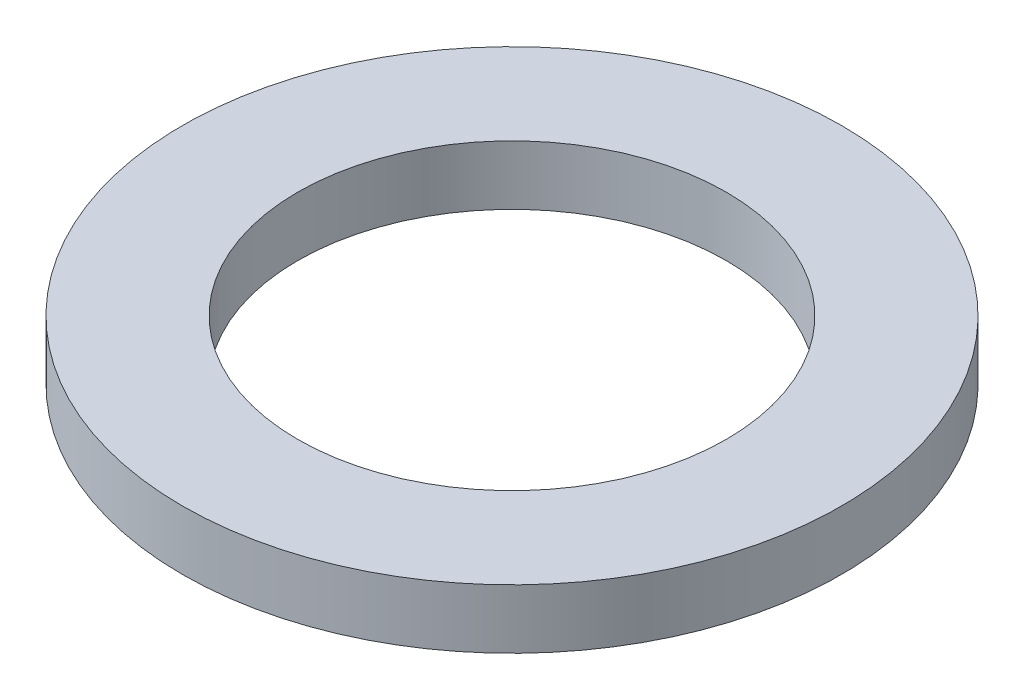
from build123d import *

# Parameters (mm, degrees)
SKETCH1_R           = 50
BOSS_EXTRUDE1_DEPTH = 9
SKETCH2_R           = 32.5
CUT_EXTRUDE1_DEPTH  = 72.281133549


with BuildPart() as part:
    # Sketch1 → Boss-Extrude1 (new body)
    with BuildSketch(Plane(origin=(0, 0, 0), x_dir=(1, 0, 0), z_dir=(0, 1, 0))):
        Circle(SKETCH1_R)
    extrude(amount=BOSS_EXTRUDE1_DEPTH)

    # Sketch2 → Cut-Extrude1 (cut, through all)
    with BuildSketch(Plane(origin=(0, 0, 0), x_dir=(1, 0, 0), z_dir=(0, 1, 0))):
        Circle(SKETCH2_R)
    extrude(amount=CUT_EXTRUDE1_DEPTH, mode=Mode.SUBTRACT)


solid = part.part
